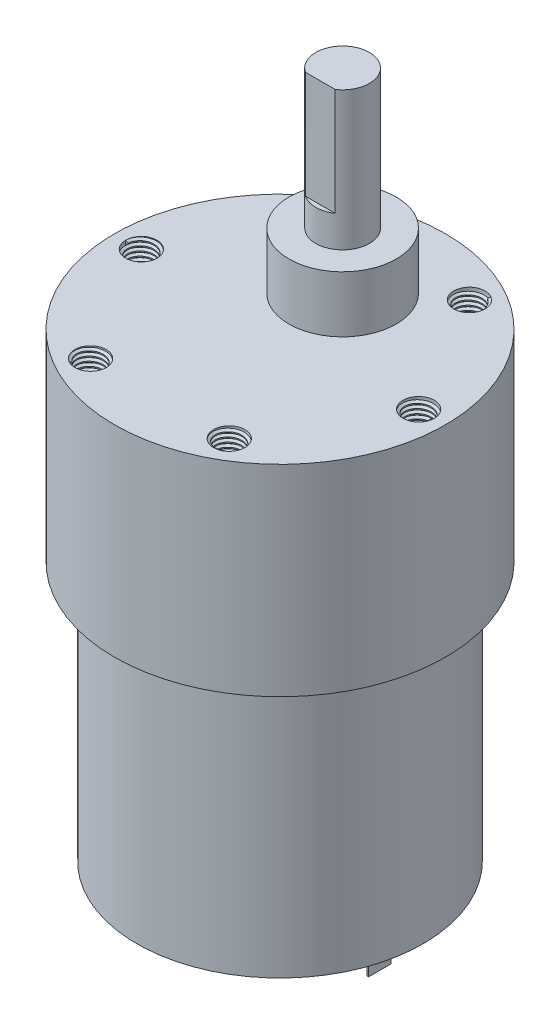
from build123d import *
from build123d.topology import SkipClean

# Parameters (mm, degrees)
SKETCH1_R           = 16
BOSS_EXTRUDE1_DEPTH = 29
SKETCH2_R           = 18.5
SKETCH2_R_2         = 16
BOSS_EXTRUDE2_DEPTH = 22.5
SKETCH3_R           = 6
BOSS_EXTRUDE3_DEPTH = 6.3
BOSS_EXTRUDE4_DEPTH = 3.5
BOSS_EXTRUDE5_START = 3.5
BOSS_EXTRUDE5_DEPTH = 12
SKETCH5_R           = 1.75
CUT_EXTRUDE2_DEPTH  = 3.5
THREAD1_PITCH       = 0.5
CIRPATTERN1_COUNT   = 6
SKETCH12_W          = 0.15
SKETCH12_H          = 2.5
BOSS_EXTRUDE6_DEPTH = 5


with BuildPart() as part:
    # Sketch1 → Boss-Extrude1 (new body)
    with BuildSketch(Plane(origin=(0, 0, 0), x_dir=(1, 0, 0), z_dir=(0, 1, 0))):
        with Locations(Location((0, 0, 0), (0, 0, 90))):
            Circle(SKETCH1_R)
    extrude(amount=BOSS_EXTRUDE1_DEPTH)

    # Sketch2 → Boss-Extrude2 (add)
    # profile 1 of 2: a face of its own
    with BuildSketch(Plane(origin=(0, 29, 0), x_dir=(1, 0, 0), z_dir=(0, 1, 0))):
        with Locations(Location((0, 0, 0), (0, 0, 90))):
            Circle(SKETCH2_R)
        with Locations(Location((0, 0, 0), (0, 0, 90))):
            Circle(SKETCH2_R_2, mode=Mode.SUBTRACT)
    # profile 2 of 2: a face of its own
    with BuildSketch(Plane(origin=(0, 29, 0), x_dir=(1, 0, 0), z_dir=(0, 1, 0))):
        with Locations(Location((0, 0, 0), (0, 0, 90))):
            Circle(SKETCH2_R_2)
    extrude(amount=BOSS_EXTRUDE2_DEPTH)

    # Sketch3 → Boss-Extrude3 (add)
    with BuildSketch(Plane(origin=(0, 51.5, 0), x_dir=(1, 0, 0), z_dir=(0, 1, 0))):
        with Locations(Location((0, 7, 0), (0, 0, 270))):
            Circle(SKETCH3_R)
    extrude(amount=BOSS_EXTRUDE3_DEPTH)

    # Sketch4 → Boss-Extrude4 (add)
    with BuildSketch(Plane(origin=(0, 57.8, 0), x_dir=(1, 0, 0), z_dir=(0, 1, 0))):
        with BuildLine():
            ThreePointArc((3, 7), (-1.418637165, 9.643382037), (-1.658312395, 4.5))
            Line((-1.658312395, 4.5), (1.658312395, 4.5))
            ThreePointArc((1.658312395, 4.5), (2.643382037, 5.581362835), (3, 7))
        make_face()
        with BuildLine():
            Line((1.658312395, 4.5), (-1.658312395, 4.5))
            ThreePointArc((-1.658312395, 4.5), (0, 4), (1.658312395, 4.5))
        make_face()
    extrude(amount=BOSS_EXTRUDE4_DEPTH)

    # Sketch4<3> → Boss-Extrude5 (add)
    with BuildSketch(Plane(origin=(0, 57.8, 0), x_dir=(1, 0, 0), z_dir=(0, 1, 0)).offset(BOSS_EXTRUDE5_START)):
        with BuildLine():
            ThreePointArc((3, 7), (-1.418637165, 9.643382037), (-1.658312395, 4.5))
            Line((-1.658312395, 4.5), (1.658312395, 4.5))
            ThreePointArc((1.658312395, 4.5), (2.643382037, 5.581362835), (3, 7))
        make_face()
    extrude(amount=BOSS_EXTRUDE5_DEPTH)

    # Sketch5 → Cut-Extrude2 (cut)
    with BuildSketch(Plane(origin=(0, 51.5, 0), x_dir=(1, 0, 0), z_dir=(0, 1, 0))):
        with Locations(Location((-15.5, 0, 0), (0, 0, 270))):
            Circle(SKETCH5_R)
    cut_extrude2 = extrude(amount=-CUT_EXTRUDE2_DEPTH, mode=Mode.SUBTRACT)

    # Thread1: the profile of Thread Profile2 profile screwed along a right-hand helix of 7 turns, 6 arcs to a turn; built about Z, then put on its axis
    with SkipClean():  # the faces are left unmerged after this step: merging them gives an invalid solid
        thread1_z = Axis((0, 0, 0), (0, 0, 1))
        thread1_corners = [(1.7503, 0, -0.000173205), (1.7503, 0, 0.437673204), (1.479367062, 0, 0.281249999), (1.479367062, 0, 0.156249999)]
        with BuildLine(mode=Mode.PRIVATE) as thread1_profile:
            Line(thread1_corners[0], thread1_corners[1])
            Line(thread1_corners[1], thread1_corners[2])
            Line(thread1_corners[2], thread1_corners[3])
            Line(thread1_corners[3], thread1_corners[0])
        thread1_cap = Face(thread1_profile.wire())
        thread1_turn_angles = [0, 30, 60, 90, 120, 150, 180, 210, 240, 270, 300, 330, 360]
        thread1_turn_weights = [1, 0.8660254037844387, 1, 0.8660254037844387, 1, 0.8660254037844387, 1, 0.8660254037844387, 1, 0.8660254037844387, 1, 0.8660254037844387, 1]
        thread1_turn_rails = [Edge.make_bspline([Vector(p[0], p[1], 0).rotate(thread1_z, thread1_turn_angles[k]) / thread1_turn_weights[k] + Vector(0, 0, p[2] + THREAD1_PITCH * thread1_turn_angles[k] / 360) for k in range(13)], [0, 0, 0, 1, 1, 2, 2, 3, 3, 4, 4, 5, 5, 6, 6, 6], 2, thread1_turn_weights) for p in thread1_corners]
        thread1_turn_sides = [Face.make_surface_from_curves(thread1_turn_rails[p[0]], thread1_turn_rails[p[1]]) for p in [(0, 1), (1, 2), (2, 3), (3, 0)]]
        thread1 = Plane(origin=(-15.5, 51.5, 0), x_dir=(-1, 0, 0), z_dir=(0, -1, 0)) * Solid(Shell([*[p.moved(Location((0, 0, THREAD1_PITCH * i))) for i in range(7) for p in thread1_turn_sides], thread1_cap, thread1_cap.rotate(thread1_z, 2520).moved(Location((0, 0, THREAD1_PITCH * 2520 / 360)))]))
        add(thread1)

    # CirPattern1: Cut-Extrude2, Thread1 ×6 about axis
    with SkipClean():  # the faces are left unmerged after this step: merging them gives an invalid solid
        cirpattern1_axis = Axis((0, 51.5, 0), (0, 1, 0))
        add([cut_extrude2.rotate(cirpattern1_axis, i * 360 / CIRPATTERN1_COUNT) for i in range(1, CIRPATTERN1_COUNT)], mode=Mode.SUBTRACT)
        add([thread1.rotate(cirpattern1_axis, i * 360 / CIRPATTERN1_COUNT) for i in range(1, CIRPATTERN1_COUNT)])

    # Sketch12 → Boss-Extrude6 (add)
    with SkipClean():  # the faces are left unmerged after this step: merging them gives an invalid solid
        with BuildSketch(Plane.XZ):
            with Locations((-11.075, 0)):
                Rectangle(SKETCH12_W, SKETCH12_H)
            with Locations((11.075, 0)):
                Rectangle(SKETCH12_W, SKETCH12_H)
        extrude(amount=BOSS_EXTRUDE6_DEPTH)


solid = part.part
